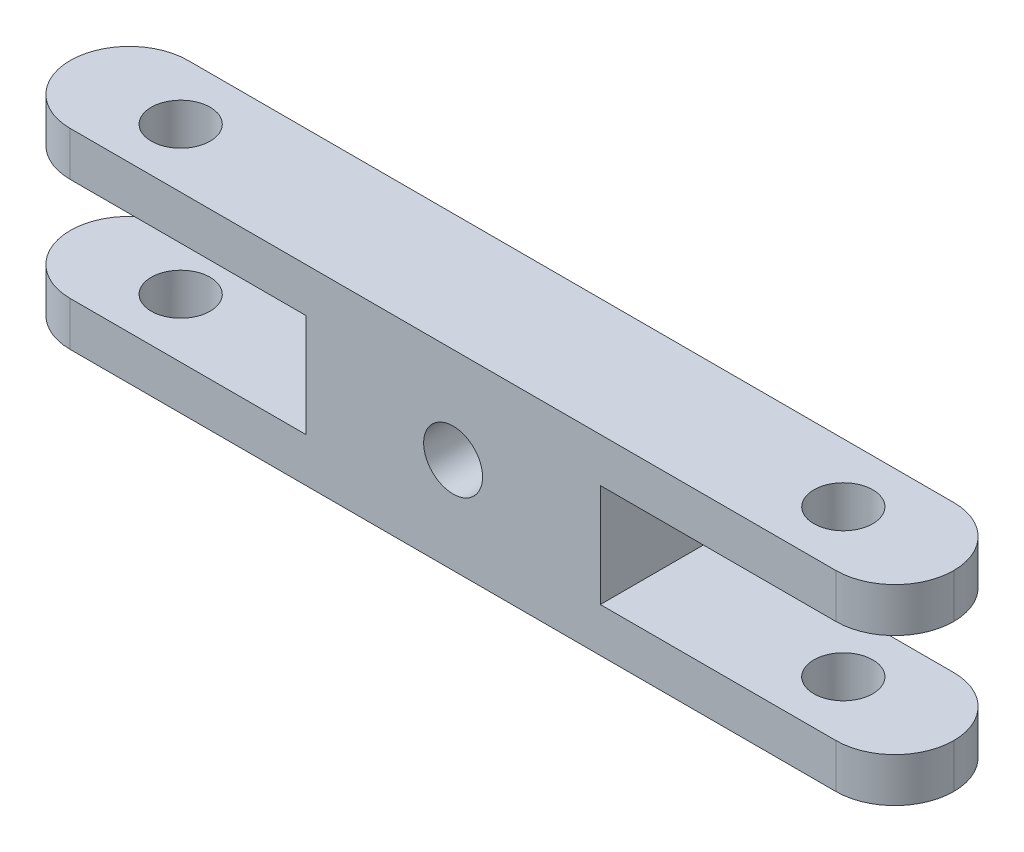
from build123d import *

# Parameters (mm, degrees)
SKETCH1_W           = 60
SKETCH1_H           = 13
BOSS_EXTRUDE1_DEPTH = 8
FILLET1_R           = 4
SKETCH2_W           = 20
SKETCH2_H           = 7
CUT_EXTRUDE1_DEPTH  = 32.721443851
SKETCH3_R           = 2
CUT_EXTRUDE2_DEPTH  = 34.660065359
SKETCH4_R           = 2
CUT_EXTRUDE3_DEPTH  = 32.721443851


with BuildPart() as part:
    # Sketch1 → Boss-Extrude1 (new body)
    with BuildSketch(Plane.XY):
        Rectangle(SKETCH1_W, SKETCH1_H)
    extrude(amount=BOSS_EXTRUDE1_DEPTH)

    # Fillet1
    fillet1_edges = [part.edges().sort_by_distance(p)[0] for p in [
        (-30, 0, 0),
        (30, 0, 0),
        (30, 0, 8),
        (-30, 0, 8),
    ]]
    fillet(fillet1_edges, radius=FILLET1_R - 0.0001)  # a hair under: the kernel refuses the full size

    # Sketch2 → Cut-Extrude1 (cut, through all)
    with BuildSketch(Plane.XY.offset(8)):
        with Locations((-20, 0)):
            Rectangle(SKETCH2_W, SKETCH2_H)
        with Locations((20, 0)):
            Rectangle(SKETCH2_W, SKETCH2_H)
    extrude(amount=-CUT_EXTRUDE1_DEPTH, mode=Mode.SUBTRACT)

    # Sketch3 → Cut-Extrude2 (cut, through all)
    with BuildSketch(Plane(origin=(0, 6.5, 0), x_dir=(1, 0, 0), z_dir=(0, 1, 0))):
        with Locations(Location((-22.5, -4, 0), (0, 0, 270))):
            Circle(SKETCH3_R)
        with Locations(Location((22.5, -4, 0), (0, 0, 270))):
            Circle(SKETCH3_R)
    extrude(amount=-CUT_EXTRUDE2_DEPTH, mode=Mode.SUBTRACT)

    # Sketch4 → Cut-Extrude3 (cut, through all)
    with BuildSketch(Plane.XY.offset(8)):
        Circle(SKETCH4_R)
    extrude(amount=-CUT_EXTRUDE3_DEPTH, mode=Mode.SUBTRACT)


solid = part.part
